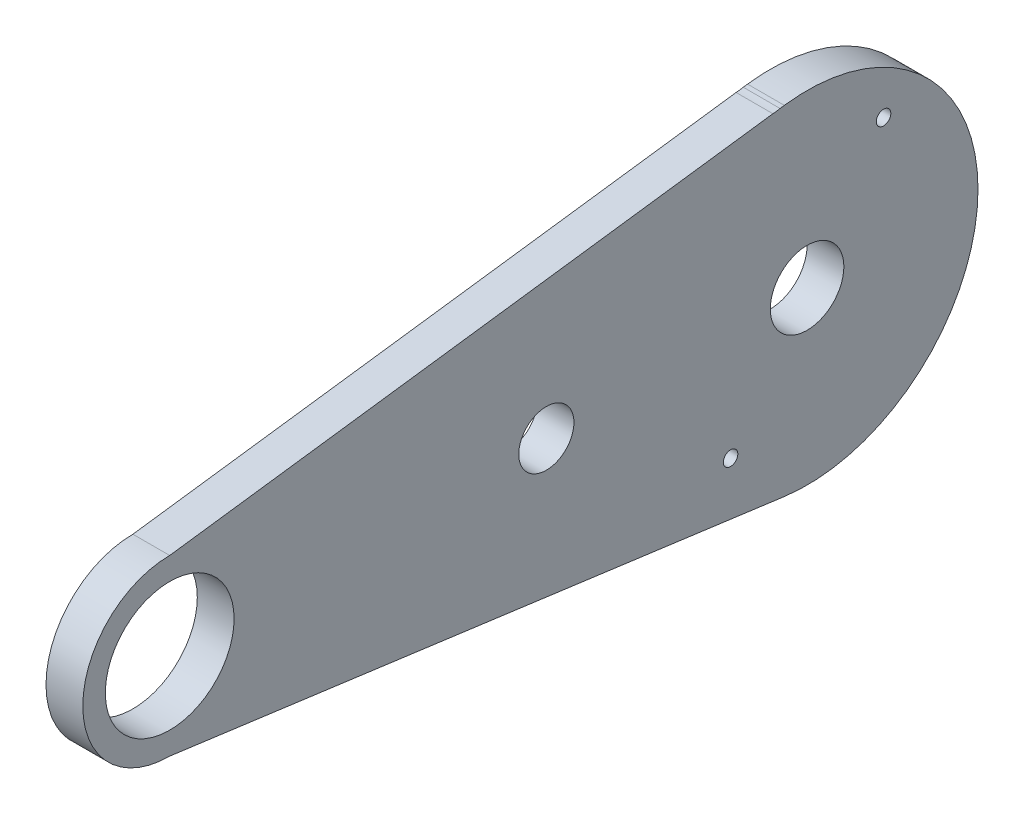
from build123d import *

# Parameters (mm, degrees)
SKETCH1_R                  = 11.1125
SKETCH1_R_2                = 6.35
BOSS_EXTRUDE1_DEPTH        = 3.175
M3X0_5_TAPPED_HOLE1_D      = 2.5
F_3_8_0_3750_DOWEL_HOLE1_D = 9.525


with BuildPart() as part:
    # Sketch1 → Boss-Extrude1 (new, symmetric)
    with BuildSketch(Plane(origin=(0, 0, 0), x_dir=(0, 0, -1), z_dir=(1, 0, 0))):
        with BuildLine():
            Line((104.098699929, 28.972456546), (0, 15))
            ThreePointArc((0, 15), (-2.052648501, 14.858890744), (-4.066677309, 14.438217884))
            ThreePointArc((-4.066677309, 14.438217884), (-14.858890744, -2.052648501), (0, -15))
            Line((0, -15), (106.075609583, -29.237803609))
            ThreePointArc((106.075609583, -29.237803609), (136.491140548, -12.979579055), (130.699290202, 21.018786481))
            ThreePointArc((130.699290202, 21.018786481), (119.340095093, 27.982362725), (106.075609583, 29.237803609))
            Line((106.075609583, 29.237803609), (105.337220563, 29.1386947))
            ThreePointArc((105.337220563, 29.1386947), (104.721310863, 29.030612592), (104.098699929, 28.972456546))
        make_face()
        Circle(SKETCH1_R, mode=Mode.SUBTRACT)
        with Locations((110, 0)):
            Circle(SKETCH1_R_2, mode=Mode.SUBTRACT)
    extrude(amount=BOSS_EXTRUDE1_DEPTH, both=True)

    # M3x0.5 Tapped Hole1 (through all)
    with Locations(Plane(origin=(3.175, 0, 0), x_dir=(0, 0, -1), z_dir=(1, 0, 0))):
        with Locations((123.200861683, 18.852784299), (110, 0), (96.799138317, -18.852784299)):
            Hole(M3X0_5_TAPPED_HOLE1_D / 2)

    # 3/8 (0.3750) Dowel Hole1 (through all)
    with Locations(Plane(origin=(3.175, 0, 0), x_dir=(0, 0, -1), z_dir=(1, 0, 0))):
        with Locations((65, 0)):
            Hole(F_3_8_0_3750_DOWEL_HOLE1_D / 2)


solid = part.part
